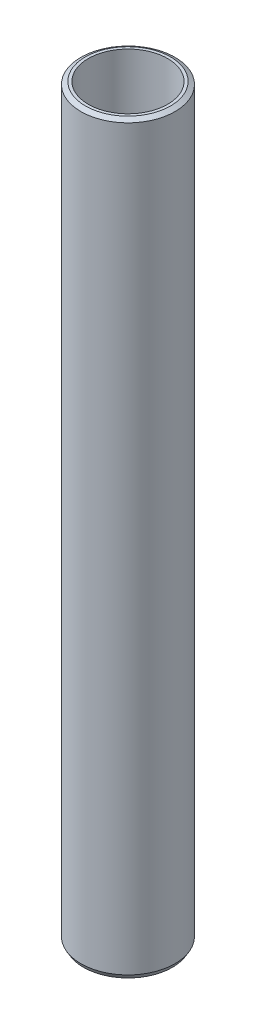
from build123d import *
from OCP.BRepFilletAPI import BRepFilletAPI_MakeChamfer

# Parameters (mm, degrees)
SKETCH1_R           = 35
BOSS_EXTRUDE1_DEPTH = 554.018841921
SKETCH2_R           = 29.514191604
CUT_EXTRUDE1_DEPTH  = 557.225563242
CHAMFER1_SIZE       = 1.935559187
CHAMFER1_SIZE2      = 3.352486852


with BuildPart() as part:
    # Sketch1 → Boss-Extrude1 (new body)
    with BuildSketch(Plane(origin=(0, 0, 0), x_dir=(1, 0, 0), z_dir=(0, 1, 0))):
        Circle(SKETCH1_R)
    extrude(amount=BOSS_EXTRUDE1_DEPTH)

    # Sketch2 → Cut-Extrude1 (cut, through all)
    with BuildSketch(Plane(origin=(0, 0, 0), x_dir=(1, 0, 0), z_dir=(0, 1, 0))):
        Circle(SKETCH2_R)
    extrude(amount=CUT_EXTRUDE1_DEPTH, mode=Mode.SUBTRACT)

    # Chamfer1: one chamfer whose edges measure the first distance from different faces: ONE call of the kernel's chamfer builder (chamfer() names one face for all edges)
    chamfer1_edges_1 = [part.edges().sort_by_distance(p)[0] for p in [
        (-35, 554.018841921, 0),
    ]]
    chamfer1_side_1 = [part.faces().sort_by_distance(p)[0] for p in [
        (-35, 277.009420961, 0),
    ]]
    chamfer1_edges_2 = [part.edges().sort_by_distance(p)[0] for p in [
        (-35, 0, 0),
    ]]
    chamfer1_side_2 = [part.faces().sort_by_distance(p)[0] for p in [
        (-34.010050506, 0, 0),
    ]]
    chamfer1 = BRepFilletAPI_MakeChamfer(part.part.solid().wrapped)
    for e in chamfer1_edges_1:
        chamfer1.Add(CHAMFER1_SIZE, CHAMFER1_SIZE2, e.wrapped, chamfer1_side_1[0].wrapped)  # the first distance lies on this face
    for e in chamfer1_edges_2:
        chamfer1.Add(CHAMFER1_SIZE, CHAMFER1_SIZE2, e.wrapped, chamfer1_side_2[0].wrapped)  # the first distance lies on this face
    add(Compound.cast(chamfer1.Shape()), mode=Mode.REPLACE)


solid = part.part
